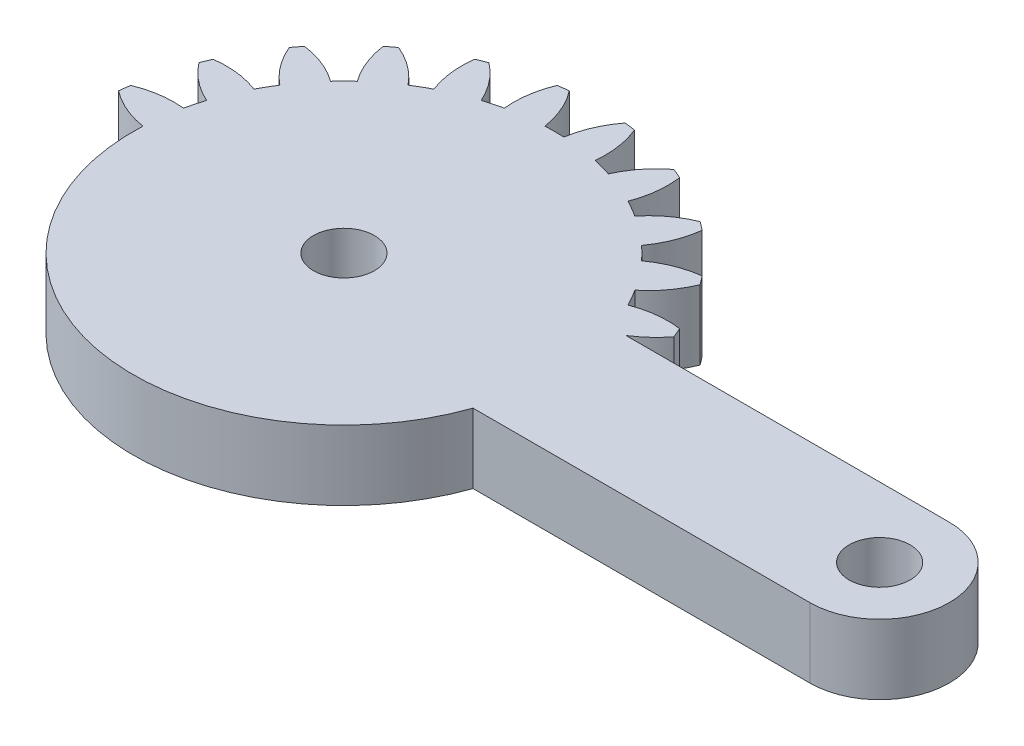
from build123d import *
from build123d.topology import SkipClean

# Parameters (mm, degrees)
SKETCH1_R           = 1.75
BOSS_EXTRUDE1_DEPTH = 4
CUT_EXTRUDE1_START  = -10
CUT_EXTRUDE1_DEPTH  = 10


with BuildPart() as part:
    # Sketch1 → Boss-Extrude1 (new body)
    with BuildSketch(Plane(origin=(0, 0, 0), x_dir=(1, 0, 0), z_dir=(0, 1, 0))):
        with BuildLine():
            Line((20.643657446, 4), (2.081641936, 4))
            ThreePointArc((2.081641936, 4), (2.861028333, 4.588201733), (3.521749436, 5.30713988))
            ThreePointArc((3.521749436, 5.30713988), (3.405395609, 5.596745198), (3.282888305, 5.883801663))
            ThreePointArc((3.282888305, 5.883801663), (1.93527598, 5.894040025), (0.627094961, 5.57027124))
            ThreePointArc((0.627094961, 5.57027124), (0.366286148, 6.046375), (0.084372603, 6.510293938))
            ThreePointArc((0.084372603, 6.510293938), (1.018855105, 7.48132754), (1.683794586, 8.65351323))
            ThreePointArc((1.683794586, 8.65351323), (1.496450048, 8.903135899), (1.303821399, 9.148703928))
            ThreePointArc((1.303821399, 9.148703928), (-0.000522033, 8.809805691), (-1.180330337, 8.158486898))
            ThreePointArc((-1.180330337, 8.158486898), (-1.555477026, 8.550865528), (-1.947855656, 8.926012217))
            ThreePointArc((-1.947855656, 8.926012217), (-1.296536862, 10.105820521), (-0.957638625, 11.410163953))
            ThreePointArc((-0.957638625, 11.410163953), (-1.203206655, 11.602792602), (-1.452829324, 11.79013714))
            ThreePointArc((-1.452829324, 11.79013714), (-2.625015014, 11.125197659), (-3.596048616, 10.190715157))
            ThreePointArc((-3.596048616, 10.190715157), (-4.059967554, 10.472628702), (-4.536071314, 10.733437515))
            ThreePointArc((-4.536071314, 10.733437515), (-4.212302529, 12.041618533), (-4.222540891, 13.389230859))
            ThreePointArc((-4.222540891, 13.389230859), (-4.509597355, 13.511738163), (-4.799202674, 13.62809199))
            ThreePointArc((-4.799202674, 13.62809199), (-5.759348103, 12.682425791), (-6.455432668, 11.528463019))
            ThreePointArc((-6.455432668, 11.528463019), (-6.976508546, 11.680699536), (-7.503891752, 11.809396783))
            ThreePointArc((-7.503891752, 11.809396783), (-7.529737283, 13.156800143), (-7.888414517, 14.455843809))
            ThreePointArc((-7.888414517, 14.455843809), (-8.197396993, 14.499881098), (-8.507248835, 14.537314892))
            ThreePointArc((-8.507248835, 14.537314892), (-9.18992168, 13.375367565), (-9.563620196, 12.080565177))
            ThreePointArc((-9.563620196, 12.080565177), (-10.106342554, 12.09275), (-10.649064912, 12.080565177))
            ThreePointArc((-10.649064912, 12.080565177), (-11.022763428, 13.375367565), (-11.705436272, 14.537314892))
            ThreePointArc((-11.705436272, 14.537314892), (-12.015288115, 14.499881098), (-12.324270591, 14.455843809))
            ThreePointArc((-12.324270591, 14.455843809), (-12.682947825, 13.156800143), (-12.708793355, 11.809396783))
            ThreePointArc((-12.708793355, 11.809396783), (-13.236176561, 11.680699536), (-13.757252439, 11.528463019))
            ThreePointArc((-13.757252439, 11.528463019), (-14.453337005, 12.682425791), (-15.413482434, 13.62809199))
            ThreePointArc((-15.413482434, 13.62809199), (-15.703087752, 13.511738163), (-15.990144217, 13.389230859))
            ThreePointArc((-15.990144217, 13.389230859), (-16.000382579, 12.041618533), (-15.676613793, 10.733437515))
            ThreePointArc((-15.676613793, 10.733437515), (-16.152717554, 10.472628702), (-16.616636492, 10.190715157))
            ThreePointArc((-16.616636492, 10.190715157), (-17.587670094, 11.125197659), (-18.759855783, 11.79013714))
            ThreePointArc((-18.759855783, 11.79013714), (-19.009478453, 11.602792602), (-19.255046482, 11.410163953))
            ThreePointArc((-19.255046482, 11.410163953), (-18.916148245, 10.105820521), (-18.264829452, 8.926012217))
            ThreePointArc((-18.264829452, 8.926012217), (-18.657208082, 8.550865528), (-19.032354771, 8.158486898))
            ThreePointArc((-19.032354771, 8.158486898), (-20.212163074, 8.809805691), (-21.516506507, 9.148703928))
            ThreePointArc((-21.516506507, 9.148703928), (-21.709135156, 8.903135899), (-21.896479694, 8.65351323))
            ThreePointArc((-21.896479694, 8.65351323), (-21.231540213, 7.48132754), (-20.297057711, 6.510293938))
            ThreePointArc((-20.297057711, 6.510293938), (-20.578971255, 6.046375), (-20.839780068, 5.57027124))
            ThreePointArc((-20.839780068, 5.57027124), (-22.147961087, 5.894040025), (-23.495573413, 5.883801663))
            ThreePointArc((-23.495573413, 5.883801663), (-23.618080717, 5.596745198), (-23.734434544, 5.30713988))
            ThreePointArc((-23.734434544, 5.30713988), (-22.788768345, 4.346994451), (-21.634805572, 3.650909885))
            ThreePointArc((-21.634805572, 3.650909885), (-21.78704209, 3.129834008), (-21.915739337, 2.602450802))
            ThreePointArc((-21.915739337, 2.602450802), (-23.263142697, 2.576605271), (-24.562186363, 2.217928037))
            ThreePointArc((-24.562186363, 2.217928037), (-24.606223651, 1.908945561), (-24.643657446, 1.599093719))
            ThreePointArc((-24.643657446, 1.599093719), (-23.481710119, 0.916420874), (-22.186907731, 0.542722358))
            ThreePointArc((-22.186907731, 0.542722358), (-22.199092554, 0), (-22.186907731, -0.542722358))
            ThreePointArc((-22.186907731, -0.542722358), (-23.481710119, -0.916420874), (-24.643657446, -1.599093719))
            ThreePointArc((-24.643657446, -1.599093719), (-24.606223651, -1.908945561), (-24.562186363, -2.217928037))
            ThreePointArc((-24.562186363, -2.217928037), (-23.263142697, -2.576605271), (-21.915739337, -2.602450802))
            ThreePointArc((-21.915739337, -2.602450802), (-21.78704209, -3.129834008), (-21.634805572, -3.650909885))
            ThreePointArc((-21.634805572, -3.650909885), (-22.788768345, -4.346994451), (-23.734434544, -5.30713988))
            ThreePointArc((-23.734434544, -5.30713988), (-23.618080717, -5.596745198), (-23.495573413, -5.883801663))
            ThreePointArc((-23.495573413, -5.883801663), (-22.147961087, -5.894040025), (-20.839780068, -5.57027124))
            ThreePointArc((-20.839780068, -5.57027124), (-20.578971255, -6.046375), (-20.297057711, -6.510293938))
            ThreePointArc((-20.297057711, -6.510293938), (-21.231540213, -7.48132754), (-21.896479694, -8.65351323))
            ThreePointArc((-21.896479694, -8.65351323), (-21.709135156, -8.903135899), (-21.516506507, -9.148703928))
            ThreePointArc((-21.516506507, -9.148703928), (-20.212163074, -8.809805691), (-19.032354771, -8.158486898))
            ThreePointArc((-19.032354771, -8.158486898), (-18.657208082, -8.550865528), (-18.264829452, -8.926012217))
            ThreePointArc((-18.264829452, -8.926012217), (-18.916148245, -10.105820521), (-19.255046482, -11.410163953))
            ThreePointArc((-19.255046482, -11.410163953), (-19.009478453, -11.602792602), (-18.759855783, -11.79013714))
            ThreePointArc((-18.759855783, -11.79013714), (-17.587670094, -11.125197659), (-16.616636492, -10.190715157))
            ThreePointArc((-16.616636492, -10.190715157), (-16.152717554, -10.472628702), (-15.676613793, -10.733437515))
            ThreePointArc((-15.676613793, -10.733437515), (-16.000382579, -12.041618533), (-15.990144217, -13.389230859))
            ThreePointArc((-15.990144217, -13.389230859), (-15.703087752, -13.511738163), (-15.413482434, -13.62809199))
            ThreePointArc((-15.413482434, -13.62809199), (-14.453337005, -12.682425791), (-13.757252439, -11.528463019))
            ThreePointArc((-13.757252439, -11.528463019), (-13.236176561, -11.680699536), (-12.708793355, -11.809396783))
            ThreePointArc((-12.708793355, -11.809396783), (-12.682947825, -13.156800143), (-12.324270591, -14.455843809))
            ThreePointArc((-12.324270591, -14.455843809), (-12.015288115, -14.499881098), (-11.705436272, -14.537314892))
            ThreePointArc((-11.705436272, -14.537314892), (-11.022763428, -13.375367565), (-10.649064912, -12.080565177))
            ThreePointArc((-10.649064912, -12.080565177), (-10.106342554, -12.09275), (-9.563620196, -12.080565177))
            ThreePointArc((-9.563620196, -12.080565177), (-9.18992168, -13.375367565), (-8.507248835, -14.537314892))
            ThreePointArc((-8.507248835, -14.537314892), (-8.197396993, -14.499881098), (-7.888414517, -14.455843809))
            ThreePointArc((-7.888414517, -14.455843809), (-7.529737283, -13.156800143), (-7.503891752, -11.809396783))
            ThreePointArc((-7.503891752, -11.809396783), (-6.976508546, -11.680699536), (-6.455432668, -11.528463019))
            ThreePointArc((-6.455432668, -11.528463019), (-5.759348103, -12.682425791), (-4.799202674, -13.62809199))
            ThreePointArc((-4.799202674, -13.62809199), (-4.509597355, -13.511738163), (-4.222540891, -13.389230859))
            ThreePointArc((-4.222540891, -13.389230859), (-4.212302529, -12.041618533), (-4.536071314, -10.733437515))
            ThreePointArc((-4.536071314, -10.733437515), (-4.059967554, -10.472628702), (-3.596048616, -10.190715157))
            ThreePointArc((-3.596048616, -10.190715157), (-2.625015014, -11.125197659), (-1.452829324, -11.79013714))
            ThreePointArc((-1.452829324, -11.79013714), (-1.203206655, -11.602792602), (-0.957638625, -11.410163953))
            ThreePointArc((-0.957638625, -11.410163953), (-1.296536862, -10.105820521), (-1.947855656, -8.926012217))
            ThreePointArc((-1.947855656, -8.926012217), (-1.555477026, -8.550865528), (-1.180330337, -8.158486898))
            ThreePointArc((-1.180330337, -8.158486898), (-0.000522033, -8.809805691), (1.303821399, -9.148703928))
            ThreePointArc((1.303821399, -9.148703928), (1.496450048, -8.903135899), (1.683794586, -8.65351323))
            ThreePointArc((1.683794586, -8.65351323), (1.018855105, -7.48132754), (0.084372603, -6.510293938))
            ThreePointArc((0.084372603, -6.510293938), (0.366286148, -6.046375), (0.627094961, -5.57027124))
            ThreePointArc((0.627094961, -5.57027124), (1.93527598, -5.894040025), (3.282888305, -5.883801663))
            ThreePointArc((3.282888305, -5.883801663), (3.405395609, -5.596745198), (3.521749436, -5.30713988))
            ThreePointArc((3.521749436, -5.30713988), (2.861028333, -4.588201733), (2.081641936, -4))
            Line((2.081641936, -4), (20.643657446, -4))
            ThreePointArc((20.643657446, -4), (24.643657446, 0), (20.643657446, 4))
        make_face()
        with Locations((-10.106342554, 0)):
            Circle(SKETCH1_R, mode=Mode.SUBTRACT)
        with Locations((20.643657446, 0)):
            Circle(SKETCH1_R, mode=Mode.SUBTRACT)
    extrude(amount=BOSS_EXTRUDE1_DEPTH)

    # Sketch2 → Cut-Extrude1 (cut)
    with SkipClean():  # the faces are left unmerged after this step: merging them gives an invalid solid
        with BuildSketch(Plane(origin=(0, 4, 0), x_dir=(1, 0, 0), z_dir=(0, 1, 0)).offset(CUT_EXTRUDE1_START)):
            with BuildLine():
                ThreePointArc((3.521749436, -5.30713988), (2.861028333, -4.588201733), (2.081641936, -4))
                Line((2.081641936, -4), (1.305695063, -4))
                ThreePointArc((1.305695063, -4), (0.994195953, -4.797149927), (0.627094961, -5.57027124))
                ThreePointArc((0.627094961, -5.57027124), (1.93527598, -5.894040025), (3.282888305, -5.883801663))
                ThreePointArc((3.282888305, -5.883801663), (3.405395609, -5.596745198), (3.521749436, -5.30713988))
            make_face()
            with BuildLine():
                ThreePointArc((1.683794586, -8.65351323), (1.018855105, -7.48132754), (0.084372603, -6.510293938))
                ThreePointArc((0.084372603, -6.510293938), (-0.512518948, -7.361599771), (-1.180330337, -8.158486898))
                ThreePointArc((-1.180330337, -8.158486898), (-0.000522033, -8.809805691), (1.303821399, -9.148703928))
                ThreePointArc((1.303821399, -9.148703928), (1.496450048, -8.903135899), (1.683794586, -8.65351323))
            make_face()
            with BuildLine():
                ThreePointArc((-0.957638625, -11.410163953), (-1.296536862, -10.105820521), (-1.947855656, -8.926012217))
                ThreePointArc((-1.947855656, -8.926012217), (-2.744742783, -9.593823606), (-3.596048616, -10.190715157))
                ThreePointArc((-3.596048616, -10.190715157), (-2.625015014, -11.125197659), (-1.452829324, -11.79013714))
                ThreePointArc((-1.452829324, -11.79013714), (-1.203206655, -11.602792602), (-0.957638625, -11.410163953))
            make_face()
            with BuildLine():
                ThreePointArc((-4.222540891, -13.389230859), (-4.212302529, -12.041618533), (-4.536071314, -10.733437515))
                ThreePointArc((-4.536071314, -10.733437515), (-5.478647477, -11.172244217), (-6.455432668, -11.528463019))
                ThreePointArc((-6.455432668, -11.528463019), (-5.759348103, -12.682425791), (-4.799202674, -13.62809199))
                ThreePointArc((-4.799202674, -13.62809199), (-4.509597355, -13.511738163), (-4.222540891, -13.389230859))
            make_face()
            with BuildLine():
                ThreePointArc((-7.888414517, -14.455843809), (-7.529737283, -13.156800143), (-7.503891752, -11.809396783))
                ThreePointArc((-7.503891752, -11.809396783), (-8.527921943, -11.989294847), (-9.563620196, -12.080565177))
                ThreePointArc((-9.563620196, -12.080565177), (-9.18992168, -13.375367565), (-8.507248835, -14.537314892))
                ThreePointArc((-8.507248835, -14.537314892), (-8.197396993, -14.499881098), (-7.888414517, -14.455843809))
            make_face()
            with BuildLine():
                ThreePointArc((-11.705436272, -14.537314892), (-11.022763428, -13.375367565), (-10.649064912, -12.080565177))
                ThreePointArc((-10.649064912, -12.080565177), (-11.684763165, -11.989294847), (-12.708793355, -11.809396783))
                ThreePointArc((-12.708793355, -11.809396783), (-12.682947825, -13.156800143), (-12.324270591, -14.455843809))
                ThreePointArc((-12.324270591, -14.455843809), (-12.015288115, -14.499881098), (-11.705436272, -14.537314892))
            make_face()
            with BuildLine():
                ThreePointArc((-15.413482434, -13.62809199), (-14.453337005, -12.682425791), (-13.757252439, -11.528463019))
                ThreePointArc((-13.757252439, -11.528463019), (-14.734037631, -11.172244217), (-15.676613793, -10.733437515))
                ThreePointArc((-15.676613793, -10.733437515), (-16.000382579, -12.041618533), (-15.990144217, -13.389230859))
                ThreePointArc((-15.990144217, -13.389230859), (-15.703087752, -13.511738163), (-15.413482434, -13.62809199))
            make_face()
            with BuildLine():
                ThreePointArc((-18.759855783, -11.79013714), (-17.587670094, -11.125197659), (-16.616636492, -10.190715157))
                ThreePointArc((-16.616636492, -10.190715157), (-17.467942324, -9.593823606), (-18.264829452, -8.926012217))
                ThreePointArc((-18.264829452, -8.926012217), (-18.916148245, -10.105820521), (-19.255046482, -11.410163953))
                ThreePointArc((-19.255046482, -11.410163953), (-19.009478453, -11.602792602), (-18.759855783, -11.79013714))
            make_face()
            with BuildLine():
                ThreePointArc((-21.516506507, -9.148703928), (-20.212163074, -8.809805691), (-19.032354771, -8.158486898))
                ThreePointArc((-19.032354771, -8.158486898), (-19.70016616, -7.361599771), (-20.297057711, -6.510293938))
                ThreePointArc((-20.297057711, -6.510293938), (-21.231540213, -7.48132754), (-21.896479694, -8.65351323))
                ThreePointArc((-21.896479694, -8.65351323), (-21.709135156, -8.903135899), (-21.516506507, -9.148703928))
            make_face()
            with BuildLine():
                ThreePointArc((-23.495573413, -5.883801663), (-22.147961087, -5.894040025), (-20.839780068, -5.57027124))
                ThreePointArc((-20.839780068, -5.57027124), (-21.278586771, -4.627695077), (-21.634805572, -3.650909885))
                ThreePointArc((-21.634805572, -3.650909885), (-22.788768345, -4.346994451), (-23.734434544, -5.30713988))
                ThreePointArc((-23.734434544, -5.30713988), (-23.618080717, -5.596745198), (-23.495573413, -5.883801663))
            make_face()
            with BuildLine():
                ThreePointArc((-24.562186363, -2.217928037), (-23.263142697, -2.576605271), (-21.915739337, -2.602450802))
                ThreePointArc((-21.915739337, -2.602450802), (-22.095637401, -1.578420611), (-22.186907731, -0.542722358))
                ThreePointArc((-22.186907731, -0.542722358), (-23.481710119, -0.916420874), (-24.643657446, -1.599093719))
                ThreePointArc((-24.643657446, -1.599093719), (-24.606223651, -1.908945561), (-24.562186363, -2.217928037))
            make_face()
        extrude(amount=CUT_EXTRUDE1_DEPTH, mode=Mode.SUBTRACT)


solid = part.part
